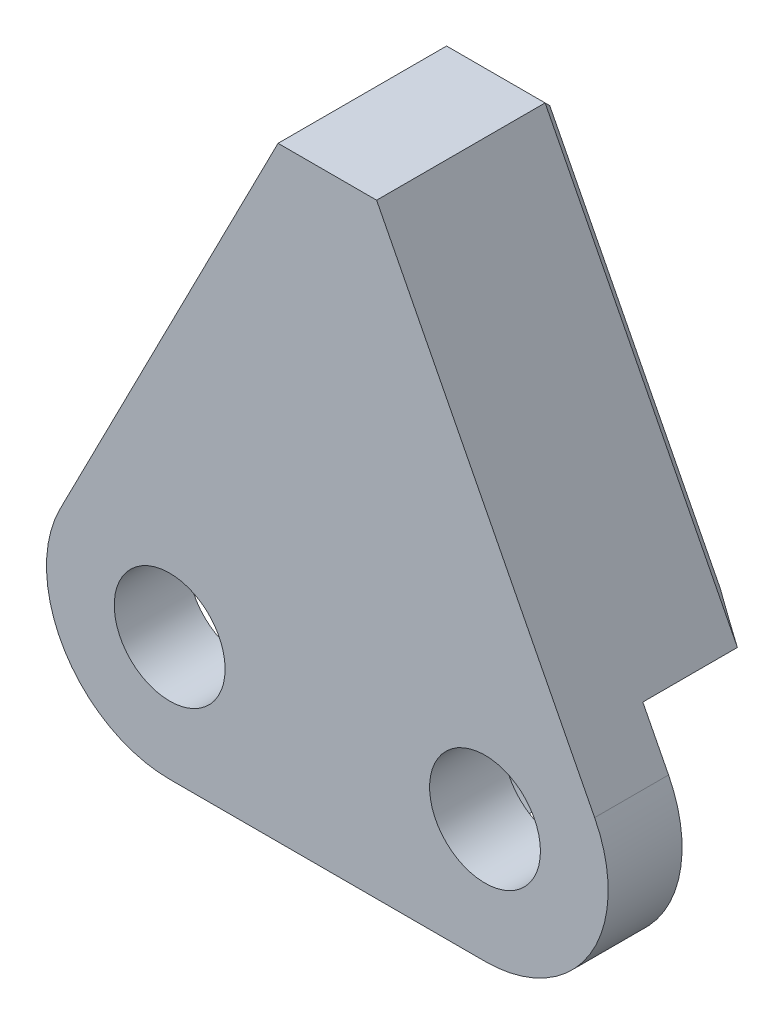
from build123d import *

# Parameters (mm, degrees)
BOSS_EXTRUDE1_DEPTH     = 4.7625
F_1_4_CLEARANCE_HOLE1_D = 7.14248
BOSS_EXTRUDE2_DEPTH     = 6.858
DRAFT1_ANGLE            = 30
FILLET1_R               = 12.7
BOSS_EXTRUDE3_DEPTH     = 6.858
CHAMFER2_SIZE           = 3.175
CHAMFER3_SIZE           = 3.175
CHAMFER1_SIZE           = 0.762


with BuildPart() as part:
    # Sketch1 → Boss-Extrude1 (new body)
    with BuildSketch(Plane.XY):
        with BuildLine():
            Line((0, -7.9375), (20.32, -7.9375))
            ThreePointArc((20.32, -7.9375), (27.092168365, -4.140246597), (27.38480555, 3.61834614))
            Line((27.38480555, 3.61834614), (13.335, 31.050532116))
            Line((13.335, 31.050532116), (6.985, 31.050532116))
            Line((6.985, 31.050532116), (-7.06480555, 3.61834614))
            ThreePointArc((-7.06480555, 3.61834614), (-6.772168365, -4.140246597), (0, -7.9375))
        make_face()
    extrude(amount=BOSS_EXTRUDE1_DEPTH)

    # 1/4 Clearance Hole1 (through all)
    with Locations(Plane.XY.offset(4.7625)):
        with Locations((0, 0), (20.32, 0)):
            Hole(F_1_4_CLEARANCE_HOLE1_D / 2)

    # Sketch6 → Boss-Extrude2 (add)
    with BuildSketch(Plane(origin=(0, 0, 0), x_dir=(-1, 0, 0), z_dir=(0, 0, -1))):
        Polygon((-16.866941061, 24.154432116), (-3.453058939, 24.154432116), (-6.985, 31.050532116), (-13.335, 31.050532116), align=None)
    extrude(amount=BOSS_EXTRUDE2_DEPTH)

    # Draft1
    draft1_faces = [part.faces().sort_by_distance(p)[0] for p in [
        (10.16, 24.154432116, -3.429),
    ]]
    draft(draft1_faces, Plane(origin=(0, 0, -6.858), x_dir=(-1, 0, 0), z_dir=(0, 0, -1)), DRAFT1_ANGLE)

    # Fillet1
    fillet1_edges = [part.edges().sort_by_distance(p)[0] for p in [
        (10.16, 20.19496397, 0),
    ]]
    fillet(fillet1_edges, radius=FILLET1_R)

    # Sketch7 → Boss-Extrude3 (add)
    with BuildSketch(Plane(origin=(0, 0, 0), x_dir=(-1, 0, 0), z_dir=(0, 0, -1))):
        with BuildLine():
            Line((-16.866941061, 24.154432116), (-3.453058939, 24.154432116))
            Line((-3.453058939, 24.154432116), (2.330214301, 12.862615551))
            Line((2.330214301, 12.862615551), (5.406671043, 6.85584676))
            ThreePointArc((5.406671043, 6.85584676), (-7.449385202, 4.554271257), (-3.637419458, -7.9375))
            Line((-3.637419458, -7.9375), (-16.682580542, -7.9375))
            ThreePointArc((-16.682580542, -7.9375), (-12.870614798, 4.554271257), (-25.726671043, 6.85584676))
            Line((-25.726671043, 6.85584676), (-22.650214301, 12.862615551))
            Line((-22.650214301, 12.862615551), (-16.866941061, 24.154432116))
        make_face()
    extrude(amount=BOSS_EXTRUDE3_DEPTH)

    # Chamfer2
    # the kernel refuses this chamfer: 3.175, 2.394981568 mm, written as the material it takes off along each edge
    with BuildSketch(Plane(origin=(3.637419458, -7.9375, 0), x_dir=(1, 0, 0), z_dir=(0, 0, -1))) as chamfer2_piece_1:
        with BuildLine():
            Line((CHAMFER2_SIZE, 0), (1.948284876, -1.226715124))
            ThreePointArc((1.948284876, -1.226715124), (1.002646954, -0.541250257), (0, 0))
            Line((0, 0), (CHAMFER2_SIZE, 0))
        make_face()
    extrude(amount=15.023093487, mode=Mode.SUBTRACT)

    # Chamfer3
    # the kernel refuses this chamfer: 3.175, 2.394981568 mm, written as the material it takes off along each edge
    with BuildSketch(Plane(origin=(16.682580542, -7.9375, 0), x_dir=(-1, 0, 0), z_dir=(0, 0, -1))) as chamfer3_piece_1:
        with BuildLine():
            Line((CHAMFER3_SIZE, 0), (1.948284876, 1.226715124))
            ThreePointArc((1.948284876, 1.226715124), (1.002646954, 0.541250257), (0, 0))
            Line((0, 0), (CHAMFER3_SIZE, 0))
        make_face()
    extrude(amount=15.023093487, mode=Mode.SUBTRACT)

    # Chamfer1
    chamfer1_edges = [part.edges().sort_by_distance(p)[0] for p in [
        (13.53609355, 5.496666248, -6.858),
        (6.78390645, 5.496666248, -6.858),
        (6.199061896, -7.324142438, -6.858),
        (10.16, -7.9375, -6.858),
        (14.120938104, -7.324142438, -6.858),
        (19.530835521, 18.953189438, -6.858),
        (0.789164479, 18.953189438, -6.858),
        (10.16, 31.050532116, -6.858),
    ]]
    chamfer(chamfer1_edges, length=CHAMFER1_SIZE)


solid = part.part
